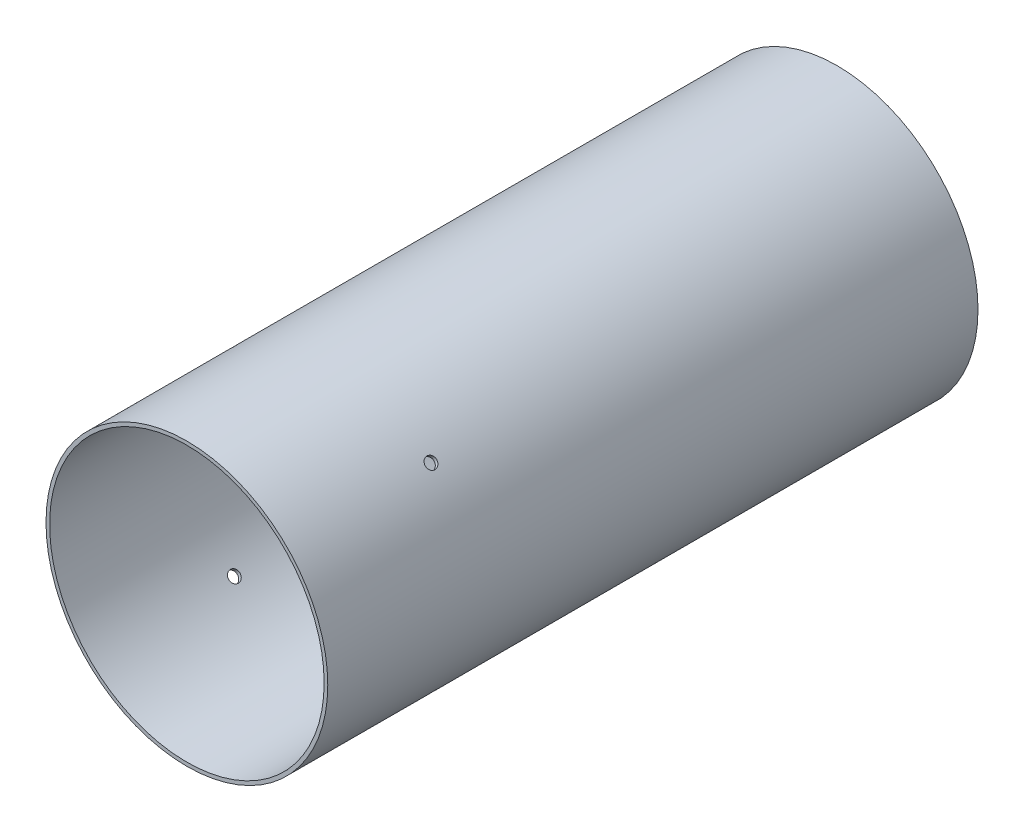
from build123d import *

# Parameters (mm, degrees)
SKETCH1_R           = 49.53
SKETCH1_R_2         = 48.26
BOSS_EXTRUDE1_DEPTH = 228.6
SKETCH2_R           = 1.984375
CUT_EXTRUDE1_DEPTH  = 12.7
CIRPATTERN1_COUNT   = 4


with BuildPart() as part:
    # Sketch1 → Boss-Extrude1 (new body)
    with BuildSketch(Plane.XY):
        Circle(SKETCH1_R)
        Circle(SKETCH1_R_2, mode=Mode.SUBTRACT)
    extrude(amount=BOSS_EXTRUDE1_DEPTH)

    # Sketch2 → Cut-Extrude1 (cut)
    with BuildSketch(Plane(origin=(-120.58027232, -48.738223352, -78.995371644), x_dir=(0.7071067811865487, 0.7071067811865465, 0), z_dir=(-0.7071067811865465, 0.7071067811865487, 0))):
        with Locations((119.72625647, -256.795371644)):
            Circle(SKETCH2_R)
    cut_extrude1 = extrude(amount=-CUT_EXTRUDE1_DEPTH, mode=Mode.SUBTRACT)

    # CirPattern1: Cut-Extrude1 ×4 about axis
    cirpattern1_axis = Axis((0, 0, 0), (0, 0, -1))
    for i in range(1, CIRPATTERN1_COUNT):
        add(cut_extrude1.rotate(cirpattern1_axis, i * 360 / CIRPATTERN1_COUNT), mode=Mode.SUBTRACT)


solid = part.part
